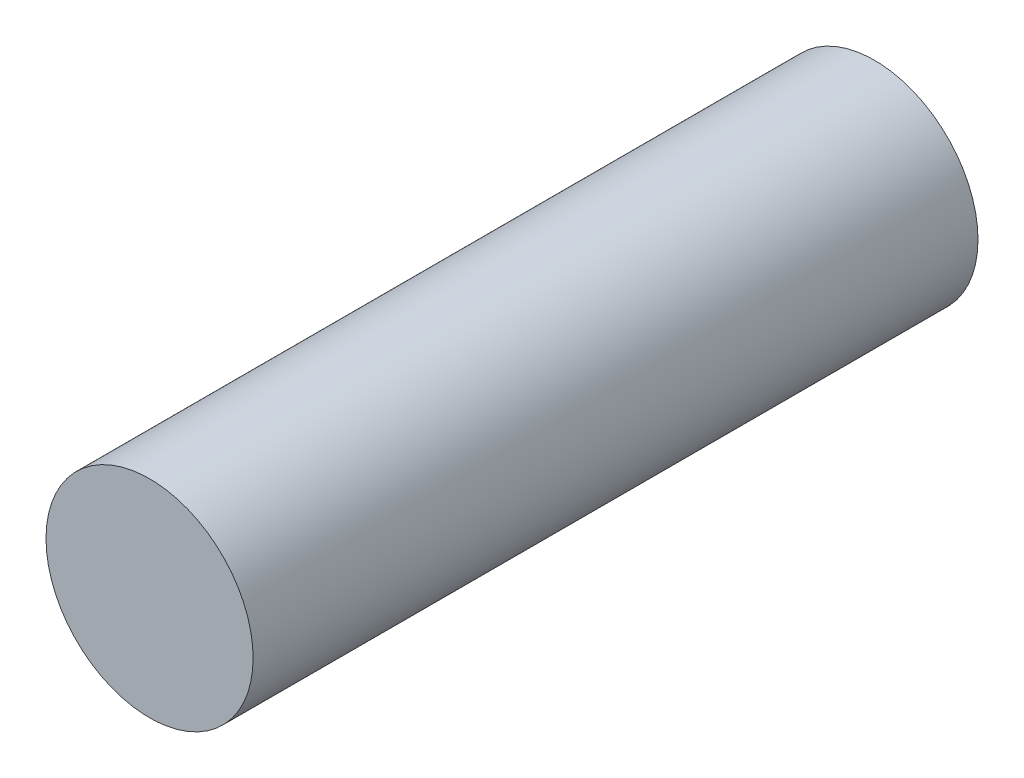
from build123d import *

# Parameters (mm, degrees)
SKETCH3_R           = 2
BOSS_EXTRUDE1_DEPTH = 14


with BuildPart() as part:
    # Sketch3 → Boss-Extrude1 (new body)
    with BuildSketch(Plane.XY):
        Circle(SKETCH3_R)
    extrude(amount=BOSS_EXTRUDE1_DEPTH)


solid = part.part
